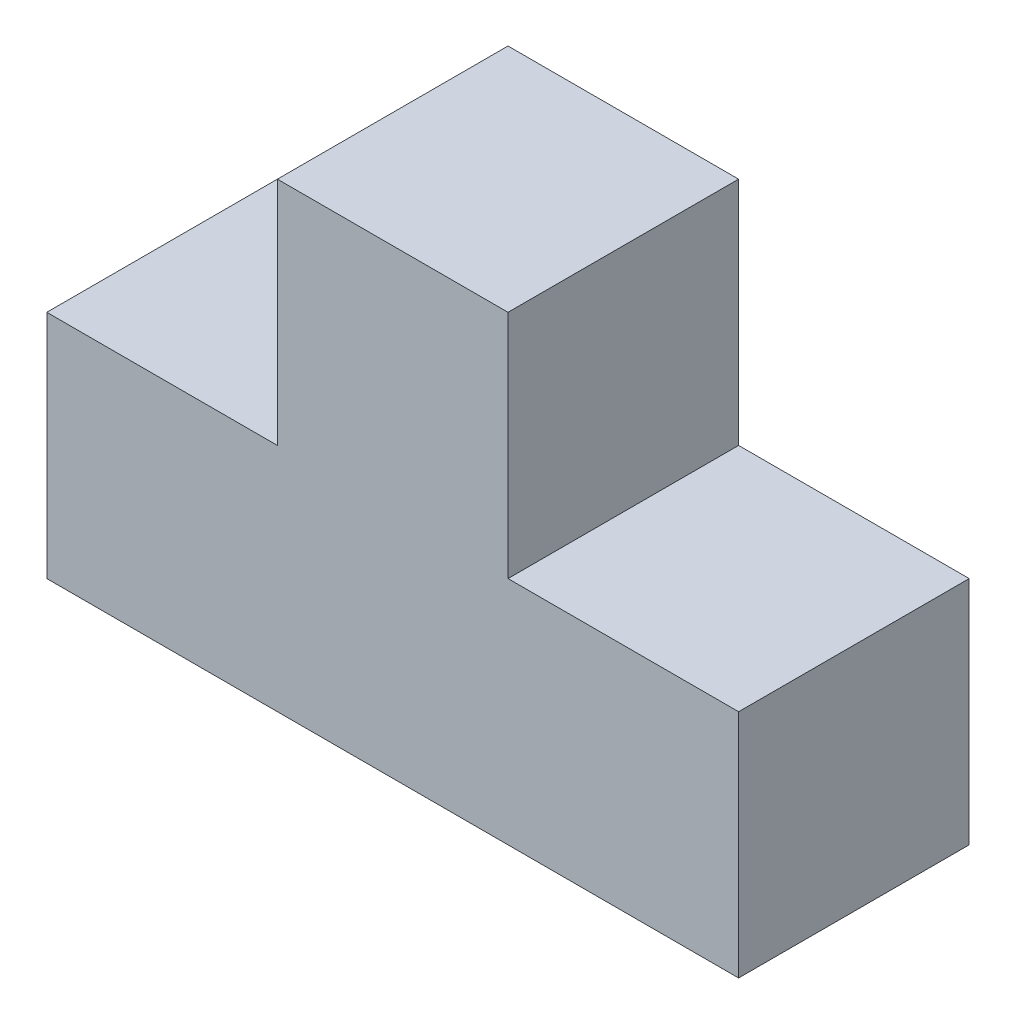
from build123d import *

# Parameters (mm, degrees)
BOSS_EXTRUDE1_DEPTH = 30


with BuildPart() as part:
    # Sketch1 → Boss-Extrude1 (new body)
    with BuildSketch(Plane.XY):
        Polygon((0, 0), (90, 0), (90, 30), (60, 30), (60, 60), (30, 60), (30, 30), (0, 30), align=None)
    extrude(amount=BOSS_EXTRUDE1_DEPTH)


solid = part.part
